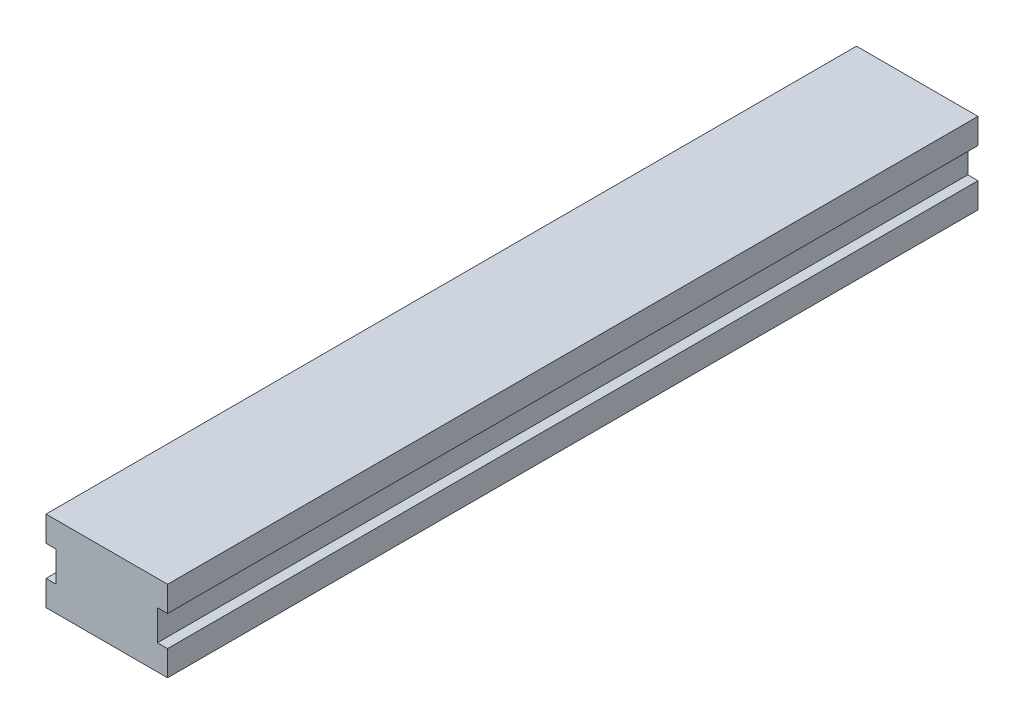
from build123d import *

# Parameters (mm, degrees)
BOSS_EXTRUDE1_DEPTH = 80


with BuildPart() as part:
    # Sketch1 → Boss-Extrude1 (new body)
    with BuildSketch(Plane.XY):
        Polygon((12, 8), (12, 5.5), (11, 5.5), (11, 2.5), (12, 2.5), (12, 0), (0, 0), (0, 2.5), (1, 2.5), (1, 5.5), (0, 5.5), (0, 8), align=None)
    extrude(amount=BOSS_EXTRUDE1_DEPTH)


solid = part.part
